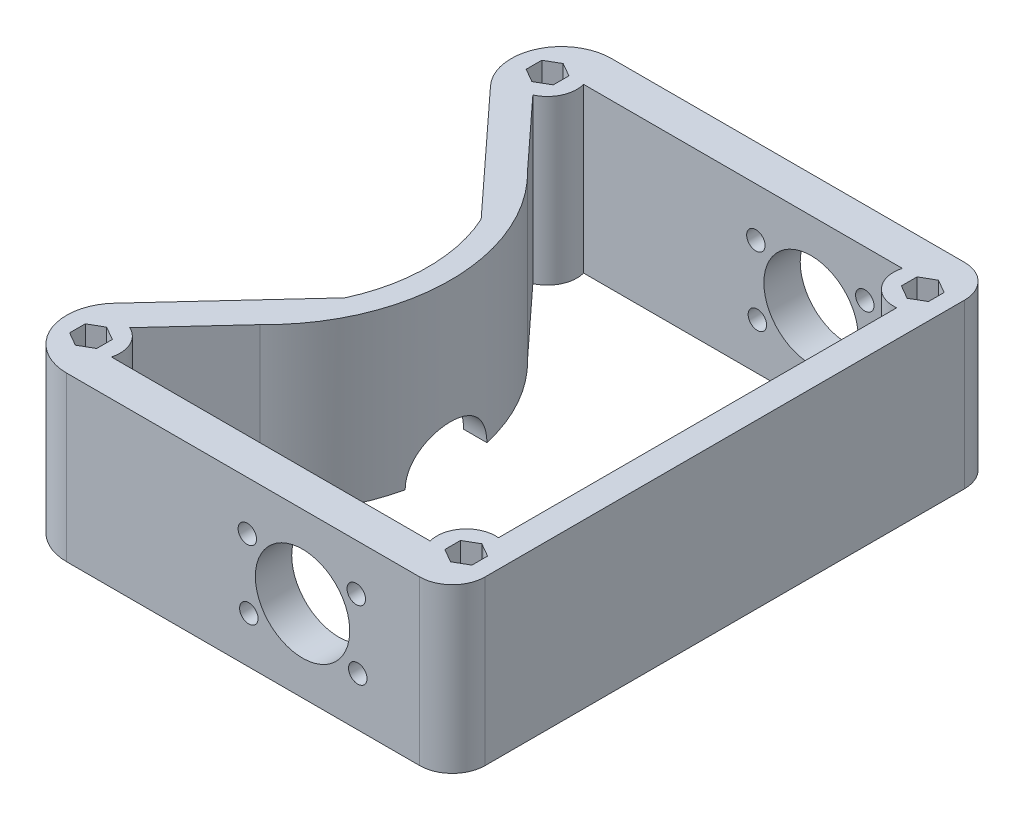
from build123d import *

# Parameters (mm, degrees)
SKETCH1_W               = 95.25
SKETCH1_H               = 8.466666667
BOSS_EXTRUDE1_DEPTH     = 38.1
SKETCH2_W               = 6.35
SKETCH2_H               = 127
BOSS_EXTRUDE2_DEPTH     = 38.1
SKETCH3_W               = 88.9
SKETCH3_H               = 8.466666667
BOSS_EXTRUDE3_DEPTH     = 38.1
SKETCH4_R               = 11
CUT_EXTRUDE1_DEPTH      = 149.412147835
SKETCH5_R               = 2.15265
CUT_EXTRUDE2_DEPTH      = 149.412147835
FILLET1_R               = 7.62
BOSS_EXTRUDE4_DEPTH     = 38.1
CUT_EXTRUDE8_REACH      = 172.773
CUT_EXTRUDE8_END_RADIUS = 38.1
FILLET2_R               = 11.688947
FILLET3_R               = 11.688947
FILLET4_R               = 6.35
BOSS_EXTRUDE7_START     = -38.1
BOSS_EXTRUDE7_DEPTH     = 38.1
CUT_EXTRUDE12_DEPTH     = 157.640484095


with BuildPart() as part:
    # Sketch1 → Boss-Extrude1 (new body)
    with BuildSketch(Plane(origin=(0, 0, 0), x_dir=(1, 0, 0), z_dir=(0, 1, 0))):
        with Locations((19.05, 13.758333334)):
            Rectangle(SKETCH1_W, SKETCH1_H)
    extrude(amount=BOSS_EXTRUDE1_DEPTH)

    # Sketch2 → Boss-Extrude2 (add)
    with BuildSketch(Plane(origin=(0, 38.1, 0), x_dir=(1, 0, 0), z_dir=(0, 1, 0))):
        with Locations((63.5, 73.025)):
            Rectangle(SKETCH2_W, SKETCH2_H)
    extrude(amount=-BOSS_EXTRUDE2_DEPTH)

    # Sketch3 → Boss-Extrude3 (add)
    with BuildSketch(Plane(origin=(0, 38.1, 0), x_dir=(1, 0, 0), z_dir=(0, 1, 0))):
        with Locations((15.875, 132.291666667)):
            Rectangle(SKETCH3_W, SKETCH3_H)
    extrude(amount=-BOSS_EXTRUDE3_DEPTH)

    # Sketch4 → Cut-Extrude1 (cut, through all)
    with BuildSketch(Plane(origin=(0, 0, -136.525), x_dir=(-1, 0, 0), z_dir=(0, 0, -1))):
        with Locations((-31.75, 19.05)):
            Circle(SKETCH4_R)
    extrude(amount=-CUT_EXTRUDE1_DEPTH, mode=Mode.SUBTRACT)

    # Sketch5 → Cut-Extrude2 (cut, through all)
    with BuildSketch(Plane(origin=(0, 0, -136.525), x_dir=(-1, 0, 0), z_dir=(0, 0, -1))):
        with Locations((-18.877667779, 26.704865736)):
            Circle(SKETCH5_R)
        with Locations((-19.228536904, 10.833743663)):
            Circle(SKETCH5_R)
        with Locations((-44.622332221, 11.395134264)):
            Circle(SKETCH5_R)
        with Locations((-44.271463096, 27.266256337)):
            Circle(SKETCH5_R)
    extrude(amount=-CUT_EXTRUDE2_DEPTH, mode=Mode.SUBTRACT)

    # Fillet1
    fillet1_edges = [part.edges().sort_by_distance(p)[0] for p in [
        (66.675, 19.05, -136.525),
        (66.675, 19.05, -9.525),
    ]]
    fillet(fillet1_edges, radius=FILLET1_R)

    # Sketch10 → Boss-Extrude4 (add)
    with BuildSketch(Plane(origin=(0, 38.1, 0), x_dir=(1, 0, 0), z_dir=(0, 1, 0))):
        with BuildLine():
            Line((-28.575, 17.991666667), (-28.575, 9.525))
            Line((-28.575, 9.525), (-34.925, 9.525))
            Line((-34.925, 9.525), (-34.925, 25.781))
            Line((-34.925, 25.781), (-5.996027965, 57.15))
            ThreePointArc((-5.996027965, 57.15), (-2.531188929, 73.025), (-5.996027965, 88.9))
            Line((-5.996027965, 88.9), (-34.925, 120.269))
            Line((-34.925, 120.269), (-34.925, 136.525))
            Line((-34.925, 136.525), (-28.575, 136.525))
            Line((-28.575, 136.525), (-28.575, 123.825))
            Line((-28.575, 123.825), (-10.494392478, 104.219375))
            ThreePointArc((-10.494392478, 104.219375), (2.742945437, 73.025), (-10.494392478, 41.830625))
            Line((-10.494392478, 41.830625), (-28.575, 22.225))
            Line((-28.575, 22.225), (-28.575, 17.991666667))
        make_face()
    extrude(amount=-BOSS_EXTRUDE4_DEPTH)

    # Cut-Extrude8: up to this cylinder (the profile starts outside it)
    cut_extrude8_end = Plane(origin=(-40.631188929, 4.042536, -73.025), z_dir=(0, 1, 0)) * Cylinder(CUT_EXTRUDE8_END_RADIUS, 422.746, mode=Mode.PRIVATE)
    # Sketch12 → Cut-Extrude8 (cut, up to the surface)
    with BuildSketch(Plane.ZY.offset(-60.325), mode=Mode.PRIVATE) as cut_extrude8_sk1:
        with BuildLine():
            Line((-82.55, 0), (-63.5, 0))
            ThreePointArc((-63.5, 0), (-73.025, 9.525), (-82.55, 0))
        make_face()
    cut_extrude8_tool1 = extrude(cut_extrude8_sk1.sketch, amount=CUT_EXTRUDE8_REACH, mode=Mode.PRIVATE) - cut_extrude8_end
    add(cut_extrude8_tool1.solids().sort_by_distance((60.325, 4.042536, -73.025))[0], mode=Mode.SUBTRACT)

    # Fillet2
    fillet2_edges = [part.edges().sort_by_distance(p)[0] for p in [
        (-34.925, 19.05, -136.525),
        (-34.925, 19.05, -120.269),
    ]]
    fillet(fillet2_edges, radius=FILLET2_R - 0.0001)  # a hair under: the kernel refuses the full size

    # Fillet3
    fillet3_edges = [part.edges().sort_by_distance(p)[0] for p in [
        (-34.925, 19.05, -25.781),
        (-34.925, 19.05, -9.525),
    ]]
    fillet(fillet3_edges, radius=FILLET3_R - 0.0001)  # a hair under: the kernel refuses the full size

    # Fillet4
    fillet4_edges = [part.edges().sort_by_distance(p)[0] for p in [
        (60.325, 19.05, -17.991666667),
        (60.325, 19.05, -128.058333333),
    ]]
    fillet(fillet4_edges, radius=FILLET4_R)

    # Sketch15 → Boss-Extrude7 (add)
    with BuildSketch(Plane(origin=(0, 38.1, 0), x_dir=(1, 0, 0), z_dir=(0, 1, 0)).offset(BOSS_EXTRUDE7_START)):
        with BuildLine():
            Line((-27.874453006, 23.470813729), (-27.581873113, 23.301892649))
            Line((-27.581873113, 23.301892649), (-25.057662874, 26.039008606))
            ThreePointArc((-25.057662874, 26.039008606), (-34.066608211, 16.896224406), (-21.277878592, 17.991666667))
            Line((-21.277878592, 17.991666667), (-24.699453006, 17.991666667))
            Line((-24.699453006, 17.991666667), (-24.699453006, 17.971552415))
            Line((-24.699453006, 17.971552415), (-27.874453006, 16.13846531))
            Line((-27.874453006, 16.13846531), (-31.049453006, 17.971552415))
            Line((-31.049453006, 17.971552415), (-31.049453006, 21.637726624))
            Line((-31.049453006, 21.637726624), (-27.874453006, 23.470813729))
        make_face()
        with BuildLine():
            Line((-27.581873113, 23.301892649), (-24.699453006, 21.637726624))
            Line((-24.699453006, 21.637726624), (-24.699453006, 17.991666667))
            Line((-24.699453006, 17.991666667), (-21.277878592, 17.991666667))
            ThreePointArc((-21.277878592, 17.991666667), (-21.094704511, 18.889940166), (-21.033278796, 19.804639519))
            ThreePointArc((-21.033278796, 19.804639519), (-22.126765794, 23.514862731), (-25.057662874, 26.039008606))
            Line((-25.057662874, 26.039008606), (-27.581873113, 23.301892649))
        make_face()
        with BuildLine():
            ThreePointArc((60.325, 26.609850645), (54.403432166, 24.225341495), (53.027878592, 17.991666667))
            Line((53.027878592, 17.991666667), (53.975, 17.991666667))
            ThreePointArc((53.975, 17.991666667), (55.237426297, 18.118421545), (56.449453006, 18.493625771))
            Line((56.449453006, 18.493625771), (56.449453006, 21.637726624))
            Line((56.449453006, 21.637726624), (59.624453006, 23.470813729))
            Line((59.624453006, 23.470813729), (60.208975135, 23.13333972))
            ThreePointArc((60.208975135, 23.13333972), (60.295927231, 23.734724375), (60.325, 24.341666667))
            Line((60.325, 24.341666667), (60.325, 26.609850645))
        make_face()
        with BuildLine():
            Line((53.975, 17.991666667), (53.027878592, 17.991666667))
            ThreePointArc((53.027878592, 17.991666667), (60.539152358, 13.024891024), (66.465627215, 19.804639519))
            ThreePointArc((66.465627215, 19.804639519), (64.703538976, 24.387711662), (60.325, 26.609850645))
            Line((60.325, 26.609850645), (60.325, 24.341666667))
            ThreePointArc((60.325, 24.341666667), (60.295927231, 23.734724375), (60.208975135, 23.13333972))
            Line((60.208975135, 23.13333972), (62.799453006, 21.637726624))
            Line((62.799453006, 21.637726624), (62.799453006, 17.971552415))
            Line((62.799453006, 17.971552415), (59.624453006, 16.13846531))
            Line((59.624453006, 16.13846531), (56.449453006, 17.971552415))
            Line((56.449453006, 17.971552415), (56.449453006, 18.493625771))
            ThreePointArc((56.449453006, 18.493625771), (55.237426297, 18.118421545), (53.975, 17.991666667))
        make_face()
        with BuildLine():
            Line((60.325, 121.708333333), (60.325, 119.440149355))
            ThreePointArc((60.325, 119.440149355), (64.703538976, 121.662288338), (66.465627215, 126.245360481))
            ThreePointArc((66.465627215, 126.245360481), (60.539152358, 133.025108976), (53.027878592, 128.058333333))
            Line((53.027878592, 128.058333333), (53.975, 128.058333333))
            ThreePointArc((53.975, 128.058333333), (55.237426297, 127.931578455), (56.449453006, 127.556374229))
            Line((56.449453006, 127.556374229), (56.449453006, 128.078447585))
            Line((56.449453006, 128.078447585), (59.624453006, 129.91153469))
            Line((59.624453006, 129.91153469), (62.799453006, 128.078447585))
            Line((62.799453006, 128.078447585), (62.799453006, 124.412273376))
            Line((62.799453006, 124.412273376), (60.208975135, 122.91666028))
            ThreePointArc((60.208975135, 122.91666028), (60.295927231, 122.315275625), (60.325, 121.708333333))
        make_face()
        with BuildLine():
            ThreePointArc((53.027878592, 128.058333333), (54.403432166, 121.824658505), (60.325, 119.440149355))
            Line((60.325, 119.440149355), (60.325, 121.708333333))
            ThreePointArc((60.325, 121.708333333), (60.295927231, 122.315275625), (60.208975135, 122.91666028))
            Line((60.208975135, 122.91666028), (59.624453006, 122.579186271))
            Line((59.624453006, 122.579186271), (56.449453006, 124.412273376))
            Line((56.449453006, 124.412273376), (56.449453006, 127.556374229))
            ThreePointArc((56.449453006, 127.556374229), (55.237426297, 127.931578455), (53.975, 128.058333333))
            Line((53.975, 128.058333333), (53.027878592, 128.058333333))
        make_face()
        with BuildLine():
            Line((-24.699453006, 128.058333333), (-21.277878592, 128.058333333))
            ThreePointArc((-21.277878592, 128.058333333), (-34.066608211, 129.153775594), (-25.057662874, 120.010991394))
            Line((-25.057662874, 120.010991394), (-27.581873113, 122.748107351))
            Line((-27.581873113, 122.748107351), (-27.874453006, 122.579186271))
            Line((-27.874453006, 122.579186271), (-31.049453006, 124.412273376))
            Line((-31.049453006, 124.412273376), (-31.049453006, 128.078447585))
            Line((-31.049453006, 128.078447585), (-27.874453006, 129.91153469))
            Line((-27.874453006, 129.91153469), (-24.699453006, 128.078447585))
            Line((-24.699453006, 128.078447585), (-24.699453006, 128.058333333))
        make_face()
        with BuildLine():
            ThreePointArc((-21.033278796, 126.245360481), (-21.094704511, 127.160059834), (-21.277878592, 128.058333333))
            Line((-21.277878592, 128.058333333), (-24.699453006, 128.058333333))
            Line((-24.699453006, 128.058333333), (-24.699453006, 124.412273376))
            Line((-24.699453006, 124.412273376), (-27.581873113, 122.748107351))
            Line((-27.581873113, 122.748107351), (-25.057662874, 120.010991394))
            ThreePointArc((-25.057662874, 120.010991394), (-22.126765794, 122.535137269), (-21.033278796, 126.245360481))
        make_face()
    extrude(amount=BOSS_EXTRUDE7_DEPTH)

    # Sketch21 → Cut-Extrude12 (cut, through all)
    with BuildSketch(Plane(origin=(0, 38.1, 0), x_dir=(1, 0, 0), z_dir=(0, 1, 0))):
        Polygon((-24.699453006, 21.637726624), (-27.857033552, 23.460756602), (-31.014614099, 21.637726624), (-31.014614099, 17.991666667), (-27.857033552, 16.168636688), (-24.699453006, 17.991666667), align=None)
        Polygon((56.449453006, 17.991666667), (56.449453006, 21.637726624), (59.607033552, 23.460756602), (62.764614099, 21.637726624), (62.764614099, 17.991666667), (59.607033552, 16.168636688), align=None)
        Polygon((59.607033552, 129.881363312), (56.449453006, 128.058333333), (56.449453006, 124.412273376), (59.607033552, 122.589243398), (62.764614099, 124.412273376), (62.764614099, 128.058333333), align=None)
        Polygon((-24.699453006, 128.058333333), (-24.699453006, 124.412273376), (-27.857033552, 122.589243398), (-31.014614099, 124.412273376), (-31.014614099, 128.058333333), (-27.857033552, 129.881363312), align=None)
    extrude(amount=-CUT_EXTRUDE12_DEPTH, mode=Mode.SUBTRACT)


solid = part.part
